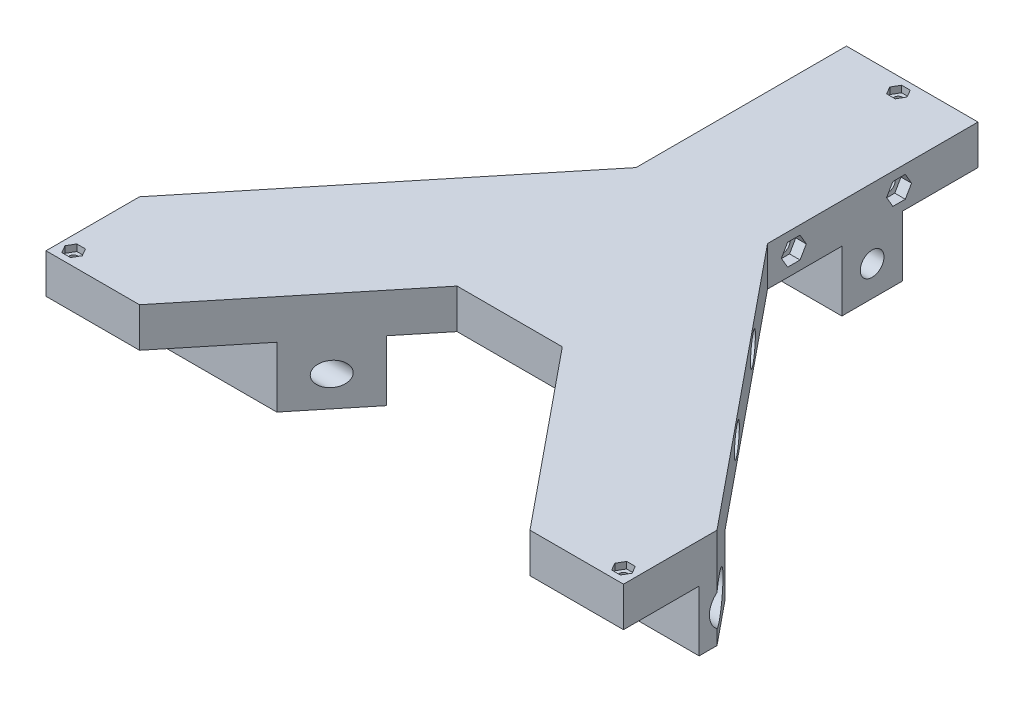
from build123d import *

# Parameters (mm, degrees)
BOSS_EXTRUDE1_DEPTH     = 15
SKETCH4_R               = 2.55
CUT_EXTRUDE1_DEPTH      = 311.78207799
CUT_EXTRUDE3_DEPTH      = 258.997698633
CUT_EXTRUDE3_DEPTH_BACK = 3.5
SKETCH5_R               = 4.25
SKETCH6_R               = 5
CUT_EXTRUDE4_DEPTH      = 258.997698633
CUT_EXTRUDE5_DEPTH      = 4
SKETCH8_R               = 1.6
CUT_EXTRUDE6_DEPTH      = 246.866452571
CUT_EXTRUDE7_DEPTH      = 2.5
SKETCH10_W              = 50
SKETCH10_H              = 23
BOSS_EXTRUDE2_DEPTH     = 23
CUT_EXTRUDE8_START      = -24
SKETCH11_R              = 7.6
CUT_EXTRUDE8_DEPTH      = 327.096577273
SKETCH12_R              = 4.5
CUT_EXTRUDE9_DEPTH      = 303.096577273
SKETCH13_R              = 4.5
CUT_EXTRUDE10_DEPTH     = 259.586180025


with BuildPart() as part:
    # Sketch1 → Boss-Extrude1 (new body)
    with BuildSketch(Plane(origin=(0, 0, 0), x_dir=(1, 0, 0), z_dir=(0, 1, 0))):
        Polygon((25, 0), (-25, 0), (-25, -80), (-109.75, -183.961915416), (-109.75, -219.5), (-74.211915416, -219.5), (-20, -152.998825191), (20, -152.998825191), (74.211915416, -219.5), (109.75, -219.5), (109.75, -183.961915416), (25, -80), align=None)
    extrude(amount=BOSS_EXTRUDE1_DEPTH)

    # Sketch4 → Cut-Extrude1 (cut, through all)
    with BuildSketch(Plane.ZY.offset(109.75)):
        with Locations((30, 7.5)):
            Circle(SKETCH4_R)
        with Locations((70, 7.5)):
            Circle(SKETCH4_R)
        with Locations((110, 7.5)):
            Circle(SKETCH4_R)
        with Locations((142.998825191, 7.5)):
            Circle(SKETCH4_R)
    extrude(amount=-CUT_EXTRUDE1_DEPTH, mode=Mode.SUBTRACT)

    # Sketch5 → Cut-Extrude3 (cut, two sides: drawn at the far end of the back side and taken through both)
    with BuildSketch(Plane.ZY.offset(25).offset(-CUT_EXTRUDE3_DEPTH_BACK)):
        with Locations((30, 7.5)):
            Circle(SKETCH5_R)
        with Locations((70, 7.5)):
            Circle(SKETCH5_R)
        with Locations((110, 7.5)):
            Circle(SKETCH5_R)
        with Locations((142.998825191, 7.5)):
            Circle(SKETCH5_R)
    extrude(amount=CUT_EXTRUDE3_DEPTH + CUT_EXTRUDE3_DEPTH_BACK, mode=Mode.SUBTRACT)

    # Sketch6 → Cut-Extrude4 (cut, through all)
    with BuildSketch(Plane(origin=(25, 0, 0), x_dir=(0, 0, -1), z_dir=(1, 0, 0))):
        with Locations((-142.998825191, 7.5)):
            Circle(SKETCH6_R)
        with Locations((-110, 7.5)):
            Circle(SKETCH6_R)
    extrude(amount=CUT_EXTRUDE4_DEPTH, mode=Mode.SUBTRACT)

    # Sketch7 → Cut-Extrude5 (cut)
    with BuildSketch(Plane(origin=(25, 0, 0), x_dir=(0, 0, -1), z_dir=(1, 0, 0))):
        Polygon((-34.734272207, 7.5), (-32.367136104, 3.4), (-27.632863896, 3.4), (-25.265727793, 7.5), (-27.632863896, 11.6), (-32.367136104, 11.6), align=None)
        Polygon((-74.734272207, 7.5), (-72.367136104, 3.4), (-67.632863896, 3.4), (-65.265727793, 7.5), (-67.632863896, 11.6), (-72.367136104, 11.6), align=None)
        Polygon((-114.734272207, 7.5), (-112.367136104, 3.4), (-107.632863896, 3.4), (-105.265727793, 7.5), (-107.632863896, 11.6), (-112.367136104, 11.6), align=None)
        Polygon((-147.733097398, 7.5), (-145.365961294, 3.4), (-140.631689087, 3.4), (-138.264552983, 7.5), (-140.631689087, 11.6), (-145.365961294, 11.6), align=None)
    extrude(amount=-CUT_EXTRUDE5_DEPTH, mode=Mode.SUBTRACT)

    # Sketch8 → Cut-Extrude6 (cut, through all)
    with BuildSketch(Plane(origin=(0, 15, 0), x_dir=(1, 0, 0), z_dir=(0, 1, 0))):
        with Locations((0, -5.25)):
            Circle(SKETCH8_R)
        with Locations((-104.5, -214.25)):
            Circle(SKETCH8_R)
        with Locations((104.5, -214.25)):
            Circle(SKETCH8_R)
    extrude(amount=-CUT_EXTRUDE6_DEPTH, mode=Mode.SUBTRACT)

    # Sketch9 → Cut-Extrude7 (cut)
    with BuildSketch(Plane(origin=(0, 15, 0), x_dir=(1, 0, 0), z_dir=(0, 1, 0))):
        Polygon((-101.209103466, -214.25), (-102.854551733, -211.4), (-106.145448267, -211.4), (-107.790896534, -214.25), (-106.145448267, -217.1), (-102.854551733, -217.1), align=None)
        Polygon((101.209103466, -214.25), (102.854551733, -217.1), (106.145448267, -217.1), (107.790896534, -214.25), (106.145448267, -211.4), (102.854551733, -211.4), align=None)
        Polygon((3.290896534, -5.25), (1.645448267, -2.4), (-1.645448267, -2.4), (-3.290896534, -5.25), (-1.645448267, -8.1), (1.645448267, -8.1), align=None)
    extrude(amount=-CUT_EXTRUDE7_DEPTH, mode=Mode.SUBTRACT)

    # Sketch10 → Boss-Extrude2 (add)
    with BuildSketch(Plane.XZ):
        with Locations((0, 40.25)):
            Rectangle(SKETCH10_W, SKETCH10_H)
        Polygon((96.534008105, 167.75), (32.025192688, 167.75), (50.774847234, 190.75), (109.75, 190.75), (109.75, 183.961915416), align=None)
        Polygon((-109.75, 190.75), (-109.75, 183.961915416), (-96.534008105, 167.75), (-32.025192688, 167.75), (-50.774847234, 190.75), align=None)
    extrude(amount=BOSS_EXTRUDE2_DEPTH)

    # Sketch11 → Cut-Extrude8 (cut)
    with BuildSketch(Plane.ZY.offset(96.534008105).offset(CUT_EXTRUDE8_START)):
        with Locations((179.25, -11.5)):
            Circle(SKETCH11_R)
    cut_extrude8 = extrude(amount=CUT_EXTRUDE8_DEPTH, mode=Mode.SUBTRACT)

    # Sketch12 → Cut-Extrude9 (cut, through all)
    with BuildSketch(Plane.ZY.offset(96.534008105)):
        with Locations((179.25, -11.5)):
            Circle(SKETCH12_R)
    extrude(amount=-CUT_EXTRUDE9_DEPTH, mode=Mode.SUBTRACT)

    # Mirror1: Cut-Extrude8 across plane
    add(cut_extrude8.mirror(Plane(origin=(0, 0, 0), x_dir=(0, 0, 1), z_dir=(1, 0, 0))), mode=Mode.SUBTRACT)

    # Sketch13 → Cut-Extrude10 (cut, through all)
    with BuildSketch(Plane.ZY.offset(25)):
        with Locations((40.25, -11.5)):
            Circle(SKETCH13_R)
    extrude(amount=-CUT_EXTRUDE10_DEPTH, mode=Mode.SUBTRACT)


solid = part.part
